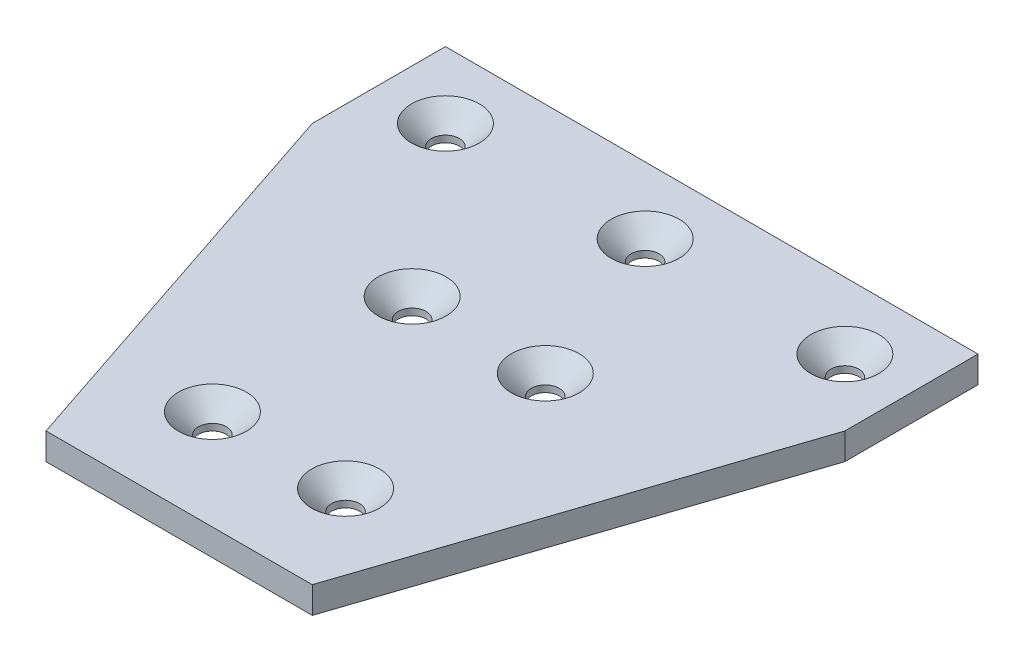
from build123d import *

# Parameters (mm, degrees)
SKETCH1_R           = 2.1
BOSS_EXTRUDE1_DEPTH = 4
CHAMFER1_SIZE       = 3


with BuildPart() as part:
    # Sketch1 → Boss-Extrude1 (new body)
    with BuildSketch(Plane(origin=(0, 0, 0), x_dir=(1, 0, 0), z_dir=(0, 1, 0))):
        Polygon((-40, 10), (-40, -10), (-20, -70), (20, -70), (40, -10), (40, 10), align=None)
        with Locations((-30, 0)):
            Circle(SKETCH1_R, mode=Mode.SUBTRACT)
        Circle(SKETCH1_R, mode=Mode.SUBTRACT)
        with Locations((30, 0)):
            Circle(SKETCH1_R, mode=Mode.SUBTRACT)
        with Locations((10, -25)):
            Circle(SKETCH1_R, mode=Mode.SUBTRACT)
        with Locations((-10, -25)):
            Circle(SKETCH1_R, mode=Mode.SUBTRACT)
        with Locations((-10, -55)):
            Circle(SKETCH1_R, mode=Mode.SUBTRACT)
        with Locations((10, -55)):
            Circle(SKETCH1_R, mode=Mode.SUBTRACT)
    extrude(amount=BOSS_EXTRUDE1_DEPTH)

    # Chamfer1
    chamfer1_edges = [part.edges().sort_by_distance(p)[0] for p in [
        (7.9, 4, 55),
        (-12.1, 4, 55),
        (7.9, 4, 25),
        (-12.1, 4, 25),
        (27.9, 4, 0),
        (-2.1, 4, 0),
        (-32.1, 4, 0),
    ]]
    chamfer(chamfer1_edges, length=CHAMFER1_SIZE)


solid = part.part
